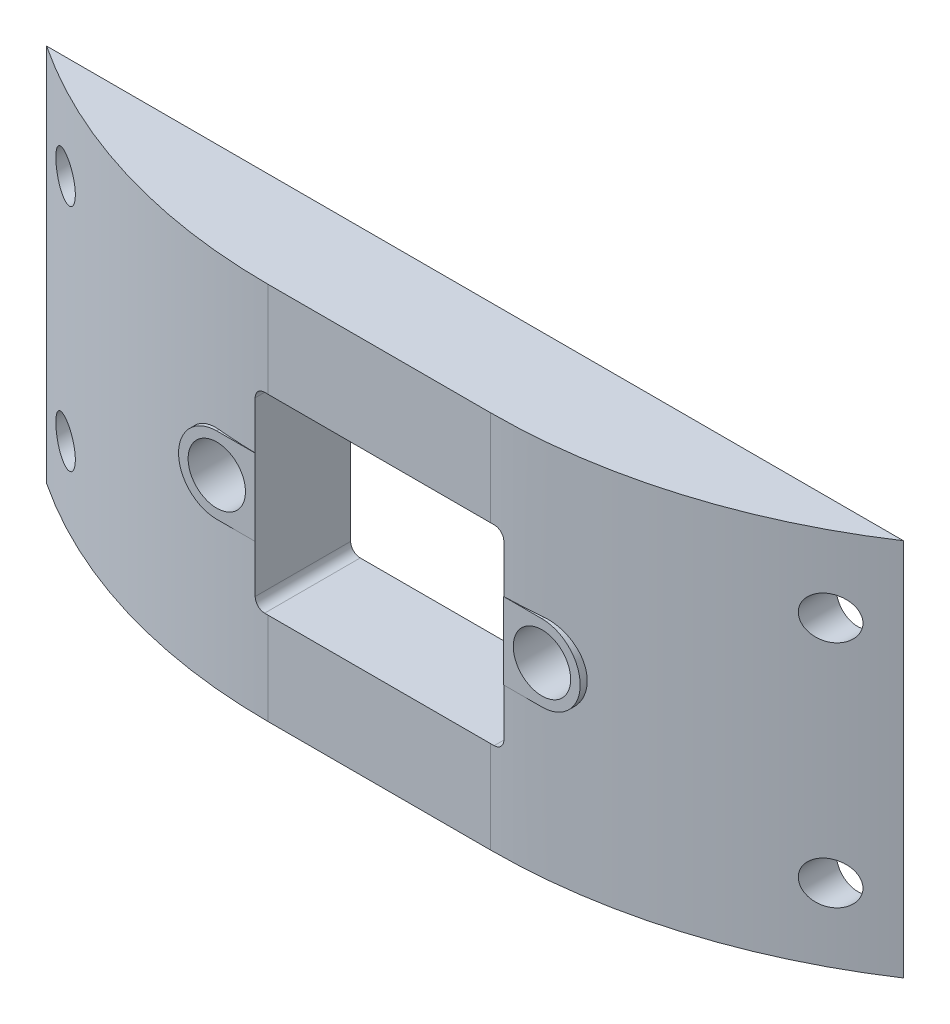
from build123d import *

# Parameters (mm, degrees)
SKETCH1_W           = 44.8
SKETCH1_H           = 19.8
BOSS_EXTRUDE1_DEPTH = 5
SKETCH2_R           = 1.1
CUT_EXTRUDE1_DEPTH  = 13
SKETCH3_R           = 1.5
CUT_EXTRUDE2_DEPTH  = 10
FILLET1_R           = 30
SKETCH4_W           = 13
SKETCH4_H           = 10
CUT_EXTRUDE3_DEPTH  = 10
BOSS_EXTRUDE2_START = -5
SKETCH5_R           = 2
SKETCH5_R_2         = 1.5
BOSS_EXTRUDE2_DEPTH = 5
FILLET2_R           = 0.5


with BuildPart() as part:
    # Sketch1 → Boss-Extrude1 (new body)
    with BuildSketch(Plane.XY):
        with Locations((0, 19.08)):
            Rectangle(SKETCH1_W, SKETCH1_H)
    extrude(amount=BOSS_EXTRUDE1_DEPTH)

    # Sketch2 → Cut-Extrude1 (cut)
    with BuildSketch(Plane.XY.offset(5)):
        with Locations((-20, 25)):
            Circle(SKETCH2_R)
        with Locations((-20, 13)):
            Circle(SKETCH2_R)
        with Locations((20, 25)):
            Circle(SKETCH2_R)
        with Locations((20, 13)):
            Circle(SKETCH2_R)
    extrude(amount=-CUT_EXTRUDE1_DEPTH, mode=Mode.SUBTRACT)

    # Sketch3 → Cut-Extrude2 (cut)
    with BuildSketch(Plane.XY.offset(5)):
        with Locations((-8.5, 19)):
            Circle(SKETCH3_R)
        with Locations((8.5, 19)):
            Circle(SKETCH3_R)
    extrude(amount=-CUT_EXTRUDE2_DEPTH, mode=Mode.SUBTRACT)

    # Fillet1
    # the kernel refuses this fillet: 30 mm, written as the material it takes off along each edge
    with BuildSketch(Plane(origin=(22.4, -32.277809879, 5), x_dir=(0, 0, -1), z_dir=(0, 1, 0)), Plane(origin=(-22.4, 70.437809879, 5), x_dir=(0, 0, -1), z_dir=(0, -1, 0))) as fillet1_piece_1:
        with BuildLine():
            CenterArc((30, 16.583123952), FILLET1_R, 180, 33.557309762)
            Line((0, 16.583123952), (-0.6, 16.583123952))
            Line((-0.6, 16.583123952), (-0.6, 0))
            Line((-0.6, 0), (0, -0.6))
            ThreePointArc((0, -0.6), (2.5, -0.6), (4.5, -0.331662479))
            Line((4.5, -0.331662479), (5, 0))
        make_face()
    extrude(amount=102.715619759, mode=Mode.SUBTRACT)

    # Sketch4 → Cut-Extrude3 (cut)
    with BuildSketch(Plane.XY.offset(5)):
        with Locations((0, 19)):
            Rectangle(SKETCH4_W, SKETCH4_H)
    extrude(amount=-CUT_EXTRUDE3_DEPTH, mode=Mode.SUBTRACT)

    # Sketch5 → Boss-Extrude2 (add)
    # profile 1 of 6: a face of its own
    with BuildSketch(Plane(origin=(0, 0, 0), x_dir=(-1, 0, 0), z_dir=(0, 0, -1)).offset(BOSS_EXTRUDE2_START)):
        with Locations((-8.5, 19)):
            Circle(SKETCH5_R)
        with Locations((-8.5, 19)):
            Circle(SKETCH5_R_2, mode=Mode.SUBTRACT)
    # profile 2 of 6: a face of its own
    with BuildSketch(Plane(origin=(0, 0, 0), x_dir=(-1, 0, 0), z_dir=(0, 0, -1)).offset(BOSS_EXTRUDE2_START)):
        with BuildLine():
            Line((-6.5, 21), (-8.5, 21))
            ThreePointArc((-8.5, 21), (-7.085786438, 20.414213562), (-6.5, 19))
            Line((-6.5, 19), (-6.5, 21))
        make_face()
    # profile 3 of 6: a face of its own
    with BuildSketch(Plane(origin=(0, 0, 0), x_dir=(-1, 0, 0), z_dir=(0, 0, -1)).offset(BOSS_EXTRUDE2_START)):
        with BuildLine():
            Line((-6.5, 17), (-6.5, 19))
            ThreePointArc((-6.5, 19), (-7.085786438, 17.585786438), (-8.5, 17))
            Line((-8.5, 17), (-6.5, 17))
        make_face()
    # profile 4 of 6: a face of its own
    with BuildSketch(Plane(origin=(0, 0, 0), x_dir=(-1, 0, 0), z_dir=(0, 0, -1)).offset(BOSS_EXTRUDE2_START)):
        with Locations((8.5, 19)):
            Circle(SKETCH5_R)
        with Locations((8.5, 19)):
            Circle(SKETCH5_R_2, mode=Mode.SUBTRACT)
    # profile 5 of 6: a face of its own
    with BuildSketch(Plane(origin=(0, 0, 0), x_dir=(-1, 0, 0), z_dir=(0, 0, -1)).offset(BOSS_EXTRUDE2_START)):
        with BuildLine():
            ThreePointArc((8.5, 17), (7.08578644, 17.585786436), (6.5, 18.999999994))
            Line((6.5, 18.999999994), (6.5, 17))
            Line((6.5, 17), (8.5, 17))
        make_face()
    # profile 6 of 6: a face of its own
    with BuildSketch(Plane(origin=(0, 0, 0), x_dir=(-1, 0, 0), z_dir=(0, 0, -1)).offset(BOSS_EXTRUDE2_START)):
        with BuildLine():
            ThreePointArc((6.5, 18.999999994), (7.085786436, 20.41421356), (8.5, 21))
            Line((8.5, 21), (6.5, 21))
            Line((6.5, 21), (6.5, 18.999999994))
        make_face()
    extrude(amount=BOSS_EXTRUDE2_DEPTH)

    # Fillet2
    fillet2_edges = [part.edges().sort_by_distance(p)[0] for p in [
        (-6.5, 14, 2.496110676),
        (-6.5, 24, 2.496110676),
        (6.5, 24, 2.496110676),
        (6.5, 14, 2.496110676),
    ]]
    fillet(fillet2_edges, radius=FILLET2_R)


solid = part.part
